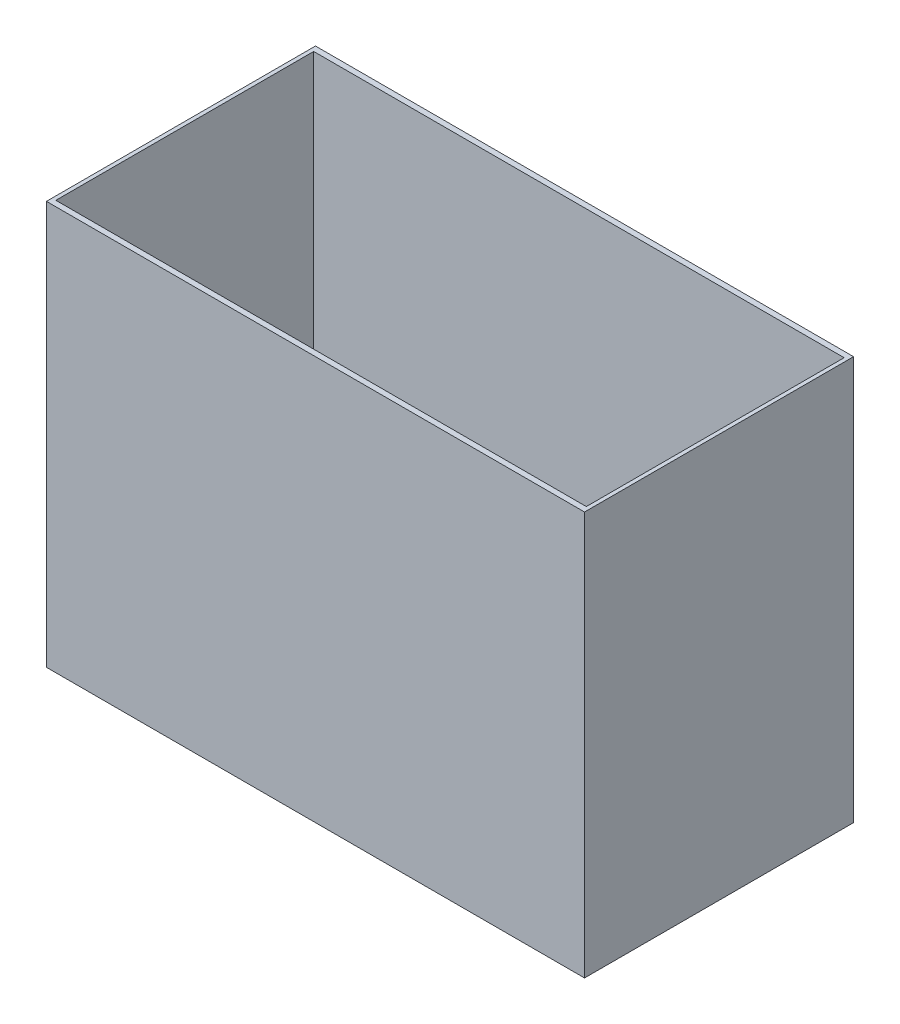
from build123d import *

# Parameters (mm, degrees)
SKETCH1_W           = 584.2
SKETCH1_H           = 279.4
BOSS_EXTRUDE1_DEPTH = 12.7
SKETCH3_W           = 609.6
SKETCH3_H           = 304.8
SKETCH3_W_2         = 600.964
SKETCH3_H_2         = 292.1
BOSS_EXTRUDE3_DEPTH = 457.2


with BuildPart() as part:
    # Sketch1 → Boss-Extrude1 (new body)
    with BuildSketch(Plane(origin=(0, 0, 0), x_dir=(1, 0, 0), z_dir=(0, 1, 0))):
        Rectangle(SKETCH1_W, SKETCH1_H)
    extrude(amount=BOSS_EXTRUDE1_DEPTH)


with BuildPart() as body_2:
    # Sketch3 → Boss-Extrude3 (new body)
    with BuildSketch(Plane(origin=(0, 0, 0), x_dir=(1, 0, 0), z_dir=(0, 1, 0))):
        Rectangle(SKETCH3_W, SKETCH3_H)
        Rectangle(SKETCH3_W_2, SKETCH3_H_2, mode=Mode.SUBTRACT)
    extrude(amount=BOSS_EXTRUDE3_DEPTH)


solid = Compound([part.part, body_2.part])
